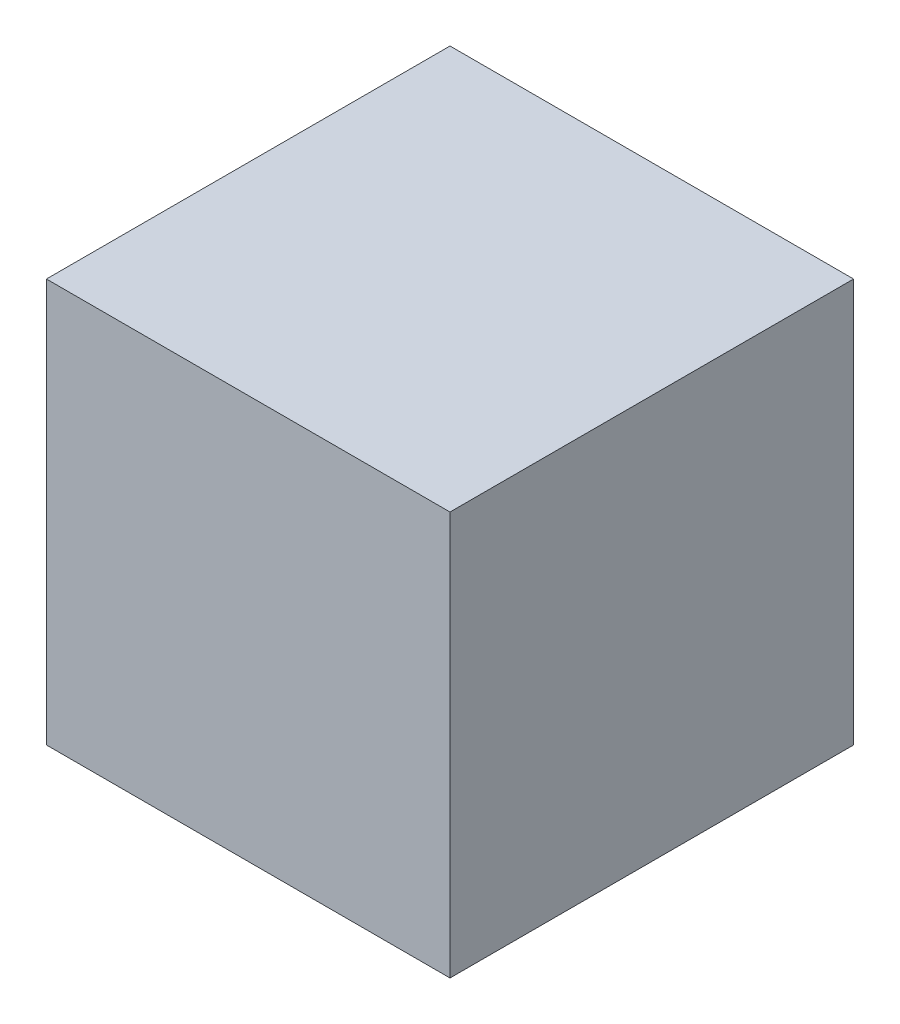
from build123d import *

# Parameters (mm, degrees)
BOSS_EXTRUDE1_DEPTH      = 250
BOSS_EXTRUDE1_DEPTH_BACK = 250
SKETCH1_W                = 500
SKETCH1_H                = 500


with BuildPart() as part:
    # Sketch1 → Boss-Extrude1 (new, two sides: drawn at the far end of the back side and taken through both)
    with BuildSketch(Plane.XY.offset(1000).offset(-BOSS_EXTRUDE1_DEPTH_BACK)):
        with Locations((1000, 1000)):
            Rectangle(SKETCH1_W, SKETCH1_H)
    extrude(amount=BOSS_EXTRUDE1_DEPTH + BOSS_EXTRUDE1_DEPTH_BACK)


solid = part.part
